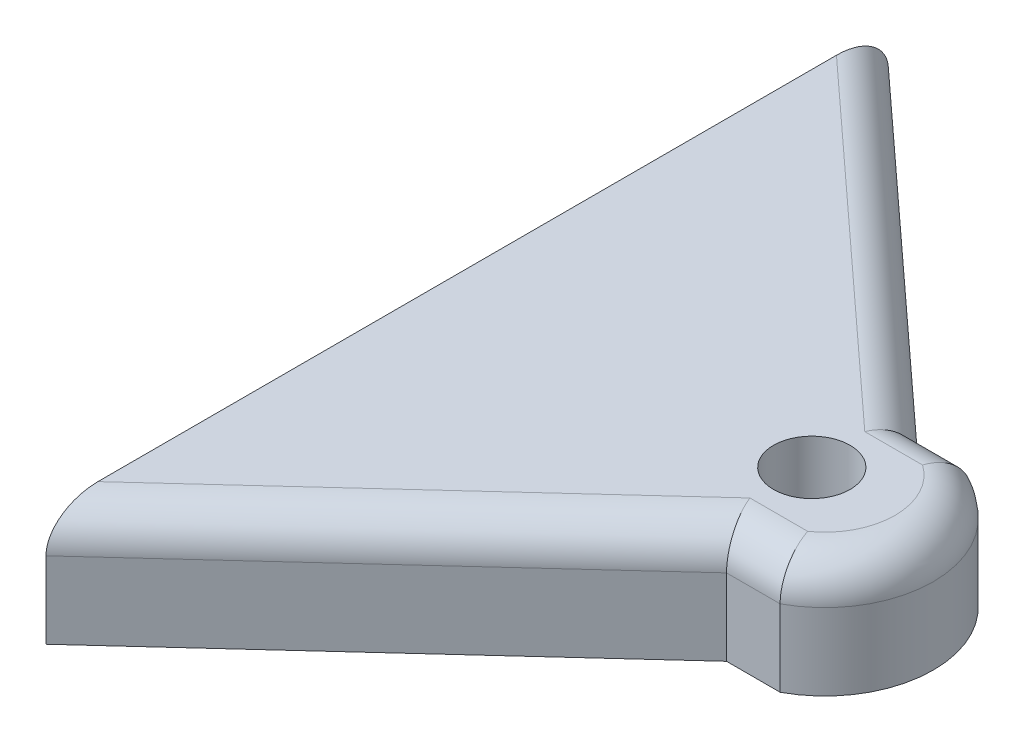
from build123d import *

# Parameters (mm, degrees)
BOSS_EXTRUDE1_DEPTH = 15
CUT_EXTRUDE2_DEPTH  = 6
SKETCH3_R           = 5
CUT_EXTRUDE3_DEPTH  = 101.031009626
SKETCH5_R           = 3.5
BOSS_EXTRUDE2_DEPTH = 3
FILLET2_R           = 5


with BuildPart() as part:
    # Sketch1 → Boss-Extrude1 (new body)
    with BuildSketch(Plane(origin=(0, 0, 0), x_dir=(1, 0, 0), z_dir=(0, 1, 0))):
        with BuildLine():
            Line((-6, 83.157587097), (-6, -26.842412903))
            Line((-6, -26.842412903), (40.363636364, 15.657587097))
            Line((40.363636364, 15.657587097), (47.363636364, 15.657587097))
            ThreePointArc((47.363636364, 15.657587097), (54.863636364, 28.157587097), (47.363636364, 40.657587097))
            Line((47.363636364, 40.657587097), (40.363636364, 40.657587097))
            Line((40.363636364, 40.657587097), (-6, 83.157587097))
        make_face()
    extrude(amount=BOSS_EXTRUDE1_DEPTH)

    # Sketch2 → Cut-Extrude2 (cut)
    with BuildSketch(Plane.XZ):
        Polygon((47.5, -19.657587097), (30.5, -19.657587097), (30.5, -24.157587097), (9.5, -24.157587097), (9.5, -32.157587097), (30.5, -32.157587097), (30.5, -36.657587097), (47.5, -36.657587097), align=None)
    extrude(amount=-CUT_EXTRUDE2_DEPTH, mode=Mode.SUBTRACT)

    # Sketch3 → Cut-Extrude3 (cut, through all)
    with BuildSketch(Plane(origin=(0, 6, 0), x_dir=(-1, 0, 0), z_dir=(0, 1, 0))):
        with Locations((-39, -28.157587097)):
            Circle(SKETCH3_R)
    extrude(amount=CUT_EXTRUDE3_DEPTH, mode=Mode.SUBTRACT)

    # Sketch5 → Boss-Extrude2 (add)
    with BuildSketch(Plane.ZY.offset(6)):
        with Locations((-53.157587097, 7)):
            Circle(SKETCH5_R)
        with Locations((-3.157587097, 7)):
            Circle(SKETCH5_R)
    extrude(amount=BOSS_EXTRUDE2_DEPTH)

    # Fillet2
    fillet2_edges = [part.edges().sort_by_distance(p)[0] for p in [
        (17.181818182, 15, -61.907587097),
        (43.863636364, 15, -40.657587097),
        (43.863636364, 15, -15.657587097),
        (17.181818182, 15, 5.592412903),
        (54.863636364, 15, -28.157587097),
    ]]
    fillet(fillet2_edges, radius=FILLET2_R)


solid = part.part
